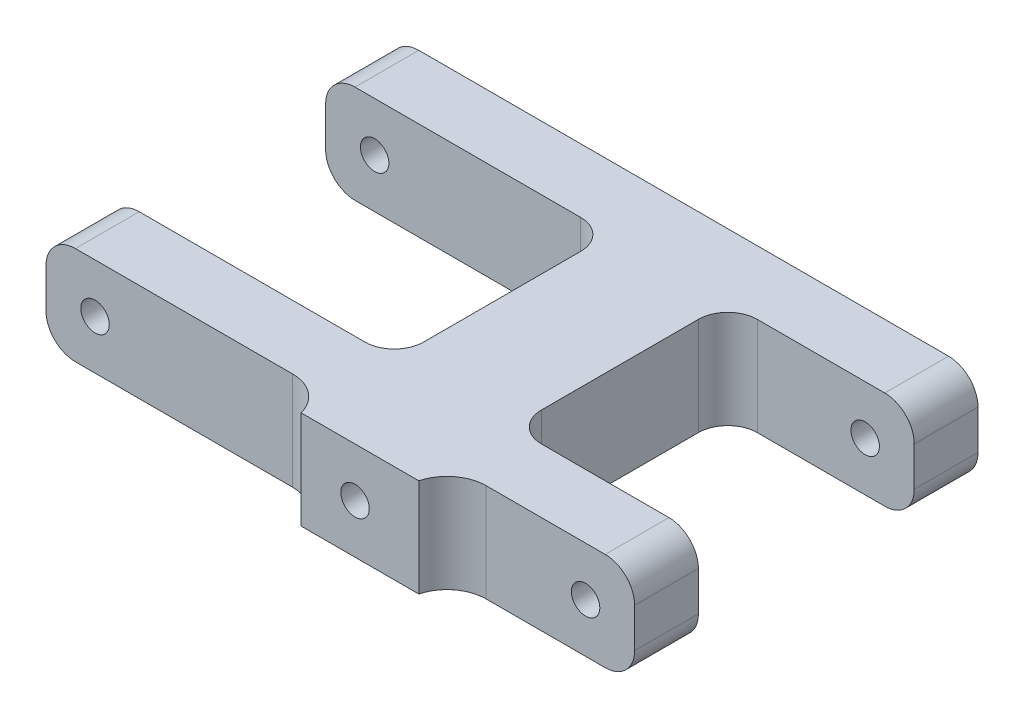
from build123d import *

# Parameters (mm, degrees)
SKETCH1_W               = 60
SKETCH1_H               = 35
BOSS_EXTRUDE1_DEPTH     = 10
SKETCH2_W               = 22
SKETCH2_H               = 10
CUT_EXTRUDE1_DEPTH      = 19
SKETCH3_W               = 22
SKETCH3_H               = 10
CUT_EXTRUDE2_DEPTH      = 29
SKETCH5_R               = 1.45
CUT_EXTRUDE4_DEPTH      = 71.178344238
FILLET1_R               = 3
FILLET2_R               = 3
SKETCH7_W               = 12
SKETCH7_H               = 10
BOSS_EXTRUDE2_DEPTH     = 3
CUT_EXTRUDE5_DEPTH      = 3
CUT_EXTRUDE5_DEPTH_BACK = 15
SKETCH6_R               = 1.45
FILLET3_R               = 4


with BuildPart() as part:
    # Sketch1 → Boss-Extrude1 (new body)
    with BuildSketch(Plane(origin=(0, 0, 0), x_dir=(1, 0, 0), z_dir=(0, 1, 0))):
        with Locations((30, -17.5)):
            Rectangle(SKETCH1_W, SKETCH1_H)
    extrude(amount=BOSS_EXTRUDE1_DEPTH)

    # Sketch2 → Cut-Extrude1 (cut)
    with BuildSketch(Plane(origin=(60, 0, 0), x_dir=(0, 0, -1), z_dir=(1, 0, 0))):
        with Locations((-17.5, 5)):
            Rectangle(SKETCH2_W, SKETCH2_H)
    extrude(amount=-CUT_EXTRUDE1_DEPTH, mode=Mode.SUBTRACT)

    # Sketch3 → Cut-Extrude2 (cut)
    with BuildSketch(Plane.ZY):
        with Locations((17.5, 5)):
            Rectangle(SKETCH3_W, SKETCH3_H)
    extrude(amount=-CUT_EXTRUDE2_DEPTH, mode=Mode.SUBTRACT)

    # Sketch5 → Cut-Extrude4 (cut, through all)
    with BuildSketch(Plane.XY.offset(35)):
        with Locations((5, 5)):
            Circle(SKETCH5_R)
        with Locations((55, 5)):
            Circle(SKETCH5_R)
    extrude(amount=-CUT_EXTRUDE4_DEPTH, mode=Mode.SUBTRACT)

    # Fillet1
    fillet1_edges = [part.edges().sort_by_distance(p)[0] for p in [
        (60, 10, 31.75),
        (60, 0, 3.25),
        (60, 10, 3.25),
        (0, 0, 31.75),
        (0, 10, 31.75),
        (0, 10, 3.25),
        (60, 0, 31.75),
        (0, 0, 3.25),
    ]]
    fillet(fillet1_edges, radius=FILLET1_R)

    # Fillet2
    fillet2_edges = [part.edges().sort_by_distance(p)[0] for p in [
        (41, 5, 28.5),
        (41, 5, 6.5),
        (29, 5, 6.5),
        (29, 5, 28.5),
    ]]
    fillet(fillet2_edges, radius=FILLET2_R)

    # Sketch7 → Boss-Extrude2 (add)
    with BuildSketch(Plane.XY.offset(35)):
        with Locations((35, 5)):
            Rectangle(SKETCH7_W, SKETCH7_H)
    extrude(amount=BOSS_EXTRUDE2_DEPTH)

    # Sketch6 → Cut-Extrude5 (cut, two sides: drawn at the far end of the back side and taken through both)
    with BuildSketch(Plane.XY.offset(35).offset(-CUT_EXTRUDE5_DEPTH_BACK)):
        with Locations((34.5, 5)):
            Circle(SKETCH6_R)
    extrude(amount=CUT_EXTRUDE5_DEPTH + CUT_EXTRUDE5_DEPTH_BACK, mode=Mode.SUBTRACT)

    # Fillet3
    # the kernel refuses this fillet: 4 mm, written as the material it adds along each edge
    with BuildSketch(Plane(origin=(41, 10, 35), x_dir=(0, 0, 1), z_dir=(0, -1, 0))) as fillet3_piece_1:
        with BuildLine():
            CenterArc((4, -3.872983346), FILLET3_R, 104.477512186, 75.522487814)
            Line((0, -3.872983346), (-0.08, -3.872983346))
            Line((-0.08, -3.872983346), (-0.08, 0))
            Line((-0.08, 0), (0, 0.08))
            ThreePointArc((0, 0.08), (1.5, 0.08), (2.98, 0.077459667))
            Line((2.98, 0.077459667), (3, 0))
        make_face()
    extrude(amount=10)
    with BuildSketch(Plane(origin=(29, 0, 35), x_dir=(-1, 0, 0), z_dir=(0, 1, 0))) as fillet3_piece_2:
        with BuildLine():
            CenterArc((3.872983346, 4), FILLET3_R, 194.477512186, 75.522487814)
            Line((0, 3), (-0.077459667, 2.98))
            ThreePointArc((-0.077459667, 2.98), (-0.08, 1.5), (-0.08, 0))
            Line((-0.08, 0), (0, -0.08))
            Line((0, -0.08), (3.872983346, -0.08))
            Line((3.872983346, -0.08), (3.872983346, 0))
        make_face()
    extrude(amount=10)


solid = part.part
